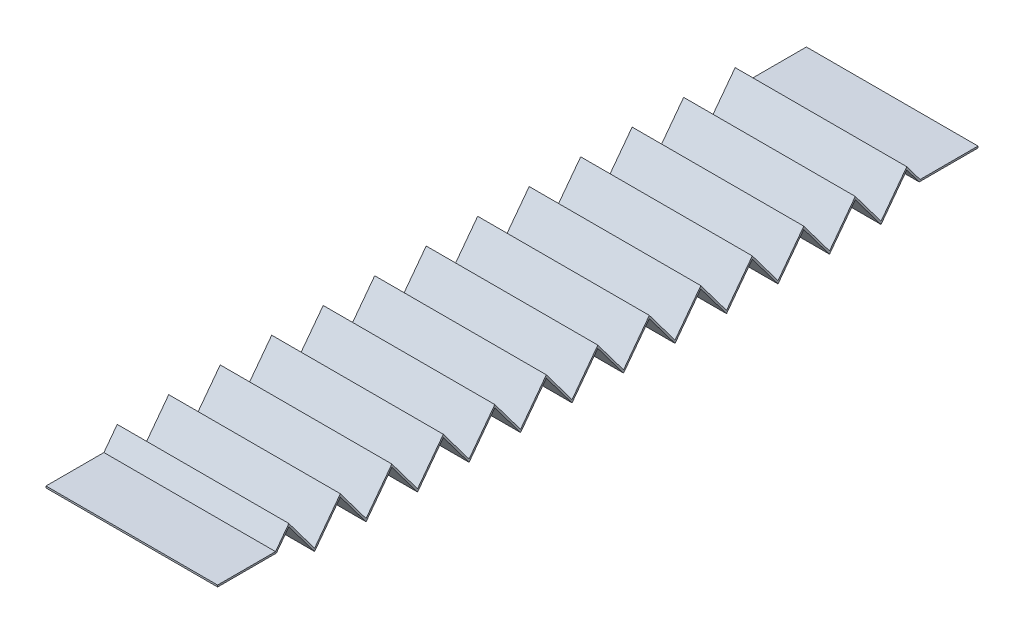
from build123d import *

# Parameters (mm, degrees)
EXTRUDE_THIN1_DEPTH = 25


with BuildPart() as part:
    # Sketch3 → Extrude-Thin1 (new, symmetric)
    with BuildSketch(Plane(origin=(0, 0, 0), x_dir=(0, 0, -1), z_dir=(1, 0, 0))):
        Polygon((0, 4.75), (17.124987671, 4.75), (20.750616503, 9.583377165), (28.251849509, -0.416622835), (35.753082515, 9.583377165), (43.254315521, -0.416622835), (50.755548526, 9.583377165), (58.256781532, -0.416622835), (65.758014538, 9.583377165), (73.259247544, -0.416622835), (80.76048055, 9.583377165), (88.261713556, -0.416622835), (95.762946562, 9.583377165), (103.264179568, -0.416622835), (110.765412573, 9.583377165), (118.266645579, -0.416622835), (125.767878585, 9.583377165), (133.269111591, -0.416622835), (140.770344597, 9.583377165), (148.271577603, -0.416622835), (155.772810609, 9.583377165), (163.274043615, -0.416622835), (170.775276621, 9.583377165), (178.276509626, -0.416622835), (185.777742632, 9.583377165), (193.278975638, -0.416622835), (200.780208644, 9.583377165), (204.405837476, 4.75), (221.530825147, 4.75), (221.530825147, 5.25), (204.655812818, 5.25), (200.780208644, 10.416622835), (193.278975638, 0.416622835), (185.777742632, 10.416622835), (178.276509626, 0.416622835), (170.775276621, 10.416622835), (163.274043615, 0.416622835), (155.772810609, 10.416622835), (148.271577603, 0.416622835), (140.770344597, 10.416622835), (133.269111591, 0.416622835), (125.767878585, 10.416622835), (118.266645579, 0.416622835), (110.765412573, 10.416622835), (103.264179568, 0.416622835), (95.762946562, 10.416622835), (88.261713556, 0.416622835), (80.76048055, 10.416622835), (73.259247544, 0.416622835), (65.758014538, 10.416622835), (58.256781532, 0.416622835), (50.755548526, 10.416622835), (43.254315521, 0.416622835), (35.753082515, 10.416622835), (28.251849509, 0.416622835), (20.750616503, 10.416622835), (16.875012329, 5.25), (0, 5.25), align=None)
    extrude(amount=EXTRUDE_THIN1_DEPTH, both=True)


solid = part.part
